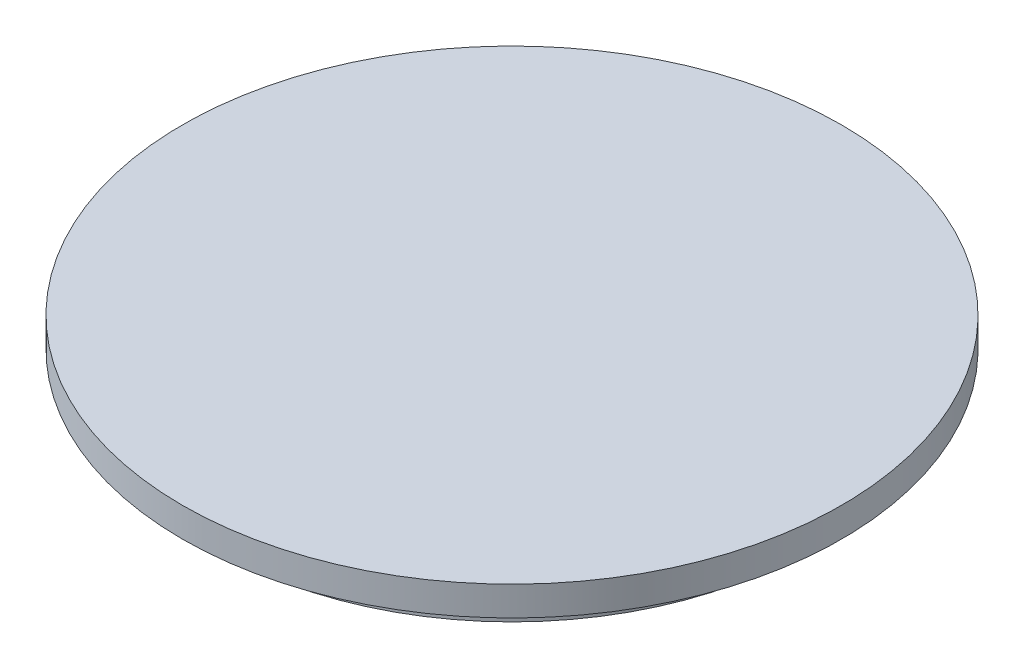
from build123d import *

# Parameters (mm, degrees)
SKIZZE1_R                       = 22.5
AUFSATZ_LINEAR_AUSTRAGEN1_DEPTH = 2
SKIZZE2_R                       = 20
SKIZZE2_R_2                     = 18
AUFSATZ_LINEAR_AUSTRAGEN2_DEPTH = 2


with BuildPart() as part:
    # Skizze1 → Aufsatz-Linear austragen1 (new body)
    with BuildSketch(Plane(origin=(0, 0, 0), x_dir=(1, 0, 0), z_dir=(0, 1, 0))):
        Circle(SKIZZE1_R)
    extrude(amount=AUFSATZ_LINEAR_AUSTRAGEN1_DEPTH)

    # Skizze2 → Aufsatz-Linear austragen2 (add)
    with BuildSketch(Plane(origin=(0, 0, 0), x_dir=(1, 0, 0), z_dir=(0, 1, 0))):
        Circle(SKIZZE2_R)
        Circle(SKIZZE2_R_2, mode=Mode.SUBTRACT)
    extrude(amount=-AUFSATZ_LINEAR_AUSTRAGEN2_DEPTH)


solid = part.part
